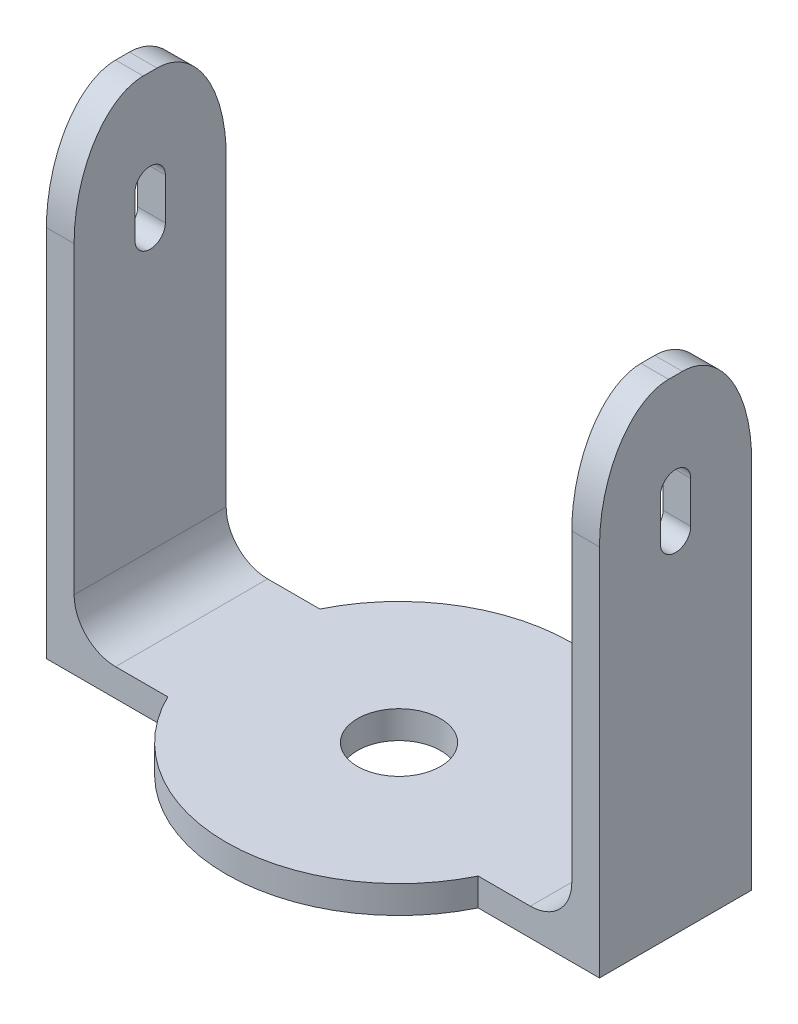
from build123d import *

# Parameters (mm, degrees)
SKETCH_1_R               = 3
EXTRUDE_1_DEPTH          = 2
SKETCH_2_W               = 2
SKETCH_2_H               = 11
EXTRUDE_2_DEPTH          = 35
FILLET_1_SIZE            = 8
FILLET_1_SIZE_2          = 5
CUT_EXTRUDE_1_DEPTH      = 55.600824307
CUT_EXTRUDE_1_DEPTH_BACK = 55.600824307
FILLET_2_R               = 3


with BuildPart() as part:
    # 草图1 → 凸台-拉伸1 (new body)
    with BuildSketch(Plane(origin=(0, 0, 0), x_dir=(1, 0, 0), z_dir=(0, 1, 0))):
        with BuildLine():
            Line((-11.22497216, 5.5), (-18, 5.5))
            Line((-18, 5.5), (-18, -5.5))
            Line((-18, -5.5), (-11.22497216, -5.5))
            ThreePointArc((-11.22497216, -5.5), (0, -12.5), (11.22497216, -5.5))
            Line((11.22497216, -5.5), (18, -5.5))
            Line((18, -5.5), (18, 5.5))
            Line((18, 5.5), (11.22497216, 5.5))
            ThreePointArc((11.22497216, 5.5), (0, 12.5), (-11.22497216, 5.5))
        make_face()
        with Locations(Location((0, 0, 0), (0, 0, 270))):
            Circle(SKETCH_1_R, mode=Mode.SUBTRACT)
    extrude(amount=EXTRUDE_1_DEPTH)

    # 草图2 → 凸台-拉伸2 (add)
    with BuildSketch(Plane(origin=(0, 0, 0), x_dir=(1, 0, 0), z_dir=(0, 1, 0))):
        with Locations((-19, 0)):
            Rectangle(SKETCH_2_W, SKETCH_2_H)
        with Locations((19, 0)):
            Rectangle(SKETCH_2_W, SKETCH_2_H)
    extrude(amount=EXTRUDE_2_DEPTH)

    # 圆角1
    # an asymmetric fillet: 8, 5 mm, written as the material it takes off along each edge
    with BuildSketch(Plane(origin=(40, 35, -5.5), x_dir=(0, -1, 0), z_dir=(-1, 0, 0)), Plane(origin=(2, 35, -5.5), x_dir=(0, -1, 0), z_dir=(-1, 0, 0)), Plane(origin=(-40, 35, 5.5), x_dir=(0, -1, 0), z_dir=(1, 0, 0))) as fillet_1_piece_1:
        with BuildLine():
            Bezier((FILLET_1_SIZE, 0), (0, 0), (0, FILLET_1_SIZE_2), weights=[1, 0.707106781, 1])
            Line((0, FILLET_1_SIZE_2), (0, 0))
            Line((0, 0), (FILLET_1_SIZE, 0))
        make_face()
    extrude(amount=42, mode=Mode.SUBTRACT)
    with BuildSketch(Plane(origin=(-2, 35, 5.5), x_dir=(0, 0, -1), z_dir=(1, 0, 0))) as fillet_1_piece_2:
        with BuildLine():
            Bezier((FILLET_1_SIZE_2, 0), (0, 0), (0, -FILLET_1_SIZE), weights=[1, 0.707106781, 1])
            Line((0, -FILLET_1_SIZE), (0, 0))
            Line((0, 0), (FILLET_1_SIZE_2, 0))
        make_face()
    extrude(amount=42, mode=Mode.SUBTRACT)

    # 草图3 → 切除-拉伸1 (cut, two sides: drawn at the far end of the back side and taken through both)
    with BuildSketch(Plane.ZY.offset(20).offset(-CUT_EXTRUDE_1_DEPTH_BACK)):
        with BuildLine():
            Line((1.1, 28), (1.1, 25))
            ThreePointArc((1.1, 25), (0, 23.9), (-1.1, 25))
            Line((-1.1, 25), (-1.1, 28))
            ThreePointArc((-1.1, 28), (0, 29.1), (1.1, 28))
        make_face()
    extrude(amount=CUT_EXTRUDE_1_DEPTH + CUT_EXTRUDE_1_DEPTH_BACK, mode=Mode.SUBTRACT)

    # 圆角2
    fillet_2_edges = [part.edges().sort_by_distance(p)[0] for p in [
        (18, 2, 0),
        (-18, 2, 0),
    ]]
    fillet(fillet_2_edges, radius=FILLET_2_R)


solid = part.part
